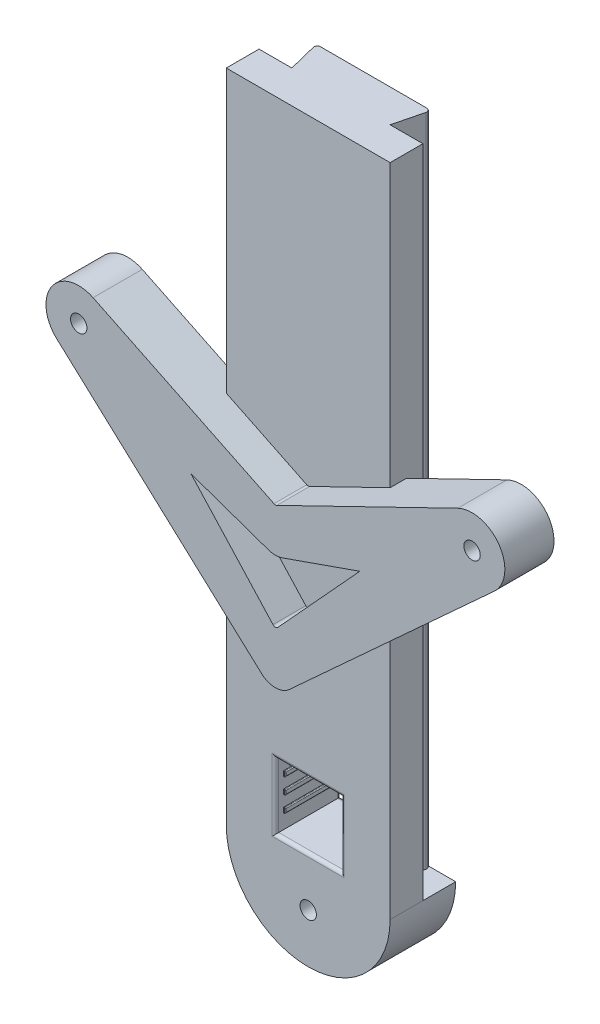
from build123d import *

# Parameters (mm, degrees)
EXTRUDE_1_DEPTH        = 40
FILLET_1_R             = 0.2
EXTRUDE_2_DEPTH        = 4
SKETCH_3_R             = 0.5
SKETCH_3_W             = 4
SKETCH_3_H             = 4
CUT_EXTRUDE_1_DEPTH    = 4
FILLET_2_R             = 0.2
SKETCH_4_W             = 3
SKETCH_4_H             = 0.3
EXTRUDE_3_DEPTH        = 0.1
FILLET_3_R             = 0.05
FILLET_3_OF_MIRROR_1_R = 0.05
SKETCH_7_R             = 0.5
EXTRUDE_4_DEPTH        = 1
EXTRUDE_START          = 2
SKETCH_7_3_R           = 0.5
EXTRUDE_5_DEPTH        = 2
FILLET_4_R             = 0.2


with BuildPart() as part:
    # 草图1 → 凸台-拉伸1 (new body)
    with BuildSketch(Plane(origin=(0, 0, 0), x_dir=(1, 0, 0), z_dir=(0, 1, 0))):
        Polygon((3.5, 2), (-3.5, 2), (-3, 0), (-5, 0), (-5, -2), (5, -2), (5, 0), (3, 0), align=None)
    extrude(amount=EXTRUDE_1_DEPTH)

    # 圆角1
    fillet_1_edges = [part.edges().sort_by_distance(p)[0] for p in [
        (3.5, 20, -2),
        (-3.5, 20, -2),
    ]]
    fillet(fillet_1_edges, radius=FILLET_1_R)

    # 草图2 → 凸台-拉伸2 (add)
    with BuildSketch(Plane.XY.offset(2)):
        with BuildLine():
            Line((-5, 0), (5, 0))
            ThreePointArc((5, 0), (0, -5), (-5, 0))
        make_face()
    extrude(amount=-EXTRUDE_2_DEPTH)

    # 草图3 → 切除-拉伸1 (cut)
    with BuildSketch(Plane.XY.offset(2)):
        with Locations((0, -2)):
            Circle(SKETCH_3_R)
        with Locations((0, 3)):
            Rectangle(SKETCH_3_W, SKETCH_3_H)
    extrude(amount=-CUT_EXTRUDE_1_DEPTH, mode=Mode.SUBTRACT)

    # 圆角2
    fillet_2_edges = [part.edges().sort_by_distance(p)[0] for p in [
        (0, 1, -2),
        (2, 3, -2),
        (0, 5, -2),
        (-2, 3, -2),
        (-2, 3, 2),
        (0, 5, 2),
        (0, 1, 2),
        (2, 3, 2),
    ]]
    fillet(fillet_2_edges, radius=FILLET_2_R)

    # 草图4 → 凸台-拉伸3 (add)
    with BuildSketch(Plane(origin=(-2, 0, 0), x_dir=(0, 0, -1), z_dir=(1, 0, 0))):
        with Locations((0, 3)):
            Rectangle(SKETCH_4_W, SKETCH_4_H)
        with Locations((0, 2.035809375)):
            Rectangle(SKETCH_4_W, SKETCH_4_H)
        with Locations((0, 3.964190625)):
            Rectangle(SKETCH_4_W, SKETCH_4_H)
    extrude_3 = extrude(amount=EXTRUDE_3_DEPTH)

    # 圆角3
    fillet_3_edges = [part.edges().sort_by_distance(p)[0] for p in [
        (-1.9, 2.035809375, 1.5),
        (-1.9, 1.885809375, 0),
        (-1.9, 2.035809375, -1.5),
        (-1.9, 2.185809375, 0),
        (-1.9, 3, 1.5),
        (-1.9, 2.85, 0),
        (-1.9, 3.15, 0),
        (-1.9, 3, -1.5),
        (-1.9, 3.964190625, 1.5),
        (-1.9, 4.114190625, 0),
        (-1.9, 3.814190625, 0),
        (-1.9, 3.964190625, -1.5),
    ]]
    fillet(fillet_3_edges, radius=FILLET_3_R)

    # 镜向1: 凸台-拉伸3 across plane
    add(extrude_3.mirror(Plane(origin=(0, 0, 0), x_dir=(0, 0, 1), z_dir=(1, 0, 0))))

    # 圆角3 of 镜向1
    fillet_3_of_mirror_1_edges = [part.edges().sort_by_distance(p)[0] for p in [
        (1.9, 2.035809375, 1.5),
        (1.9, 1.885809375, 0),
        (1.9, 2.035809375, -1.5),
        (1.9, 2.185809375, 0),
        (1.9, 3, 1.5),
        (1.9, 2.85, 0),
        (1.9, 3.15, 0),
        (1.9, 3, -1.5),
        (1.9, 3.964190625, 1.5),
        (1.9, 4.114190625, 0),
        (1.9, 3.814190625, 0),
        (1.9, 3.964190625, -1.5),
    ]]
    fillet(fillet_3_of_mirror_1_edges, radius=FILLET_3_OF_MIRROR_1_R)

    # 草图7 → 凸台-拉伸4 (add, symmetric)
    with BuildSketch(Plane.XY.offset(2)):
        with BuildLine():
            Line((0, 20.389892534), (-11.125541577, 25.798700216))
            ThreePointArc((-11.125541577, 25.798700216), (-13.654217433, 25.124083932), (-13.350331819, 22.524668181))
            Line((-13.350331819, 22.524668181), (-0.843957387, 11.077917613))
            ThreePointArc((-0.843957387, 11.077917613), (0, 10.75), (0.843957387, 11.077917613))
            Line((0.843957387, 11.077917613), (13.350331819, 22.524668181))
            ThreePointArc((13.350331819, 22.524668181), (13.654217433, 25.124083932), (11.125541577, 25.798700216))
            Line((11.125541577, 25.798700216), (0, 20.389892534))
        make_face()
        with BuildLine():
            Line((0.41340042, 17.820338992), (5.152831779, 19.481225383))
            Line((5.152831779, 19.481225383), (0, 13.851396793))
            Line((0, 13.851396793), (-5.152831779, 19.481225383))
            Line((-5.152831779, 19.481225383), (-0.41340042, 17.820338992))
            ThreePointArc((-0.41340042, 17.820338992), (0, 17.75), (0.41340042, 17.820338992))
        make_face(mode=Mode.SUBTRACT)
        with Locations((12, 24)):
            Circle(SKETCH_7_R, mode=Mode.SUBTRACT)
        with Locations((-12, 24)):
            Circle(SKETCH_7_R, mode=Mode.SUBTRACT)
    extrude(amount=EXTRUDE_4_DEPTH, both=True)

    # 草图7<3> → 凸台-拉伸5 (add)
    with BuildSketch(Plane.XY.offset(2).offset(EXTRUDE_START)):
        with BuildLine():
            Line((0, 20.389892534), (-11.125541577, 25.798700216))
            ThreePointArc((-11.125541577, 25.798700216), (-13.654217433, 25.124083932), (-13.350331819, 22.524668181))
            Line((-13.350331819, 22.524668181), (-0.843957387, 11.077917613))
            ThreePointArc((-0.843957387, 11.077917613), (0, 10.75), (0.843957387, 11.077917613))
            Line((0.843957387, 11.077917613), (13.350331819, 22.524668181))
            ThreePointArc((13.350331819, 22.524668181), (13.654217433, 25.124083932), (11.125541577, 25.798700216))
            Line((11.125541577, 25.798700216), (0, 20.389892534))
        make_face()
        with BuildLine():
            Line((0.41340042, 17.820338992), (5.152831779, 19.481225383))
            Line((5.152831779, 19.481225383), (0, 13.851396793))
            Line((0, 13.851396793), (-5.152831779, 19.481225383))
            Line((-5.152831779, 19.481225383), (-0.41340042, 17.820338992))
            ThreePointArc((-0.41340042, 17.820338992), (0, 17.75), (0.41340042, 17.820338992))
        make_face(mode=Mode.SUBTRACT)
        with Locations((12, 24)):
            Circle(SKETCH_7_3_R, mode=Mode.SUBTRACT)
        with Locations((-12, 24)):
            Circle(SKETCH_7_3_R, mode=Mode.SUBTRACT)
    extrude(amount=-EXTRUDE_5_DEPTH)

    # 圆角4
    fillet_4_edges = [part.edges().sort_by_distance(p)[0] for p in [
        (0, 20.389892534, 3),
        (0, 13.851396793, 3),
    ]]
    fillet(fillet_4_edges, radius=FILLET_4_R)


solid = part.part
